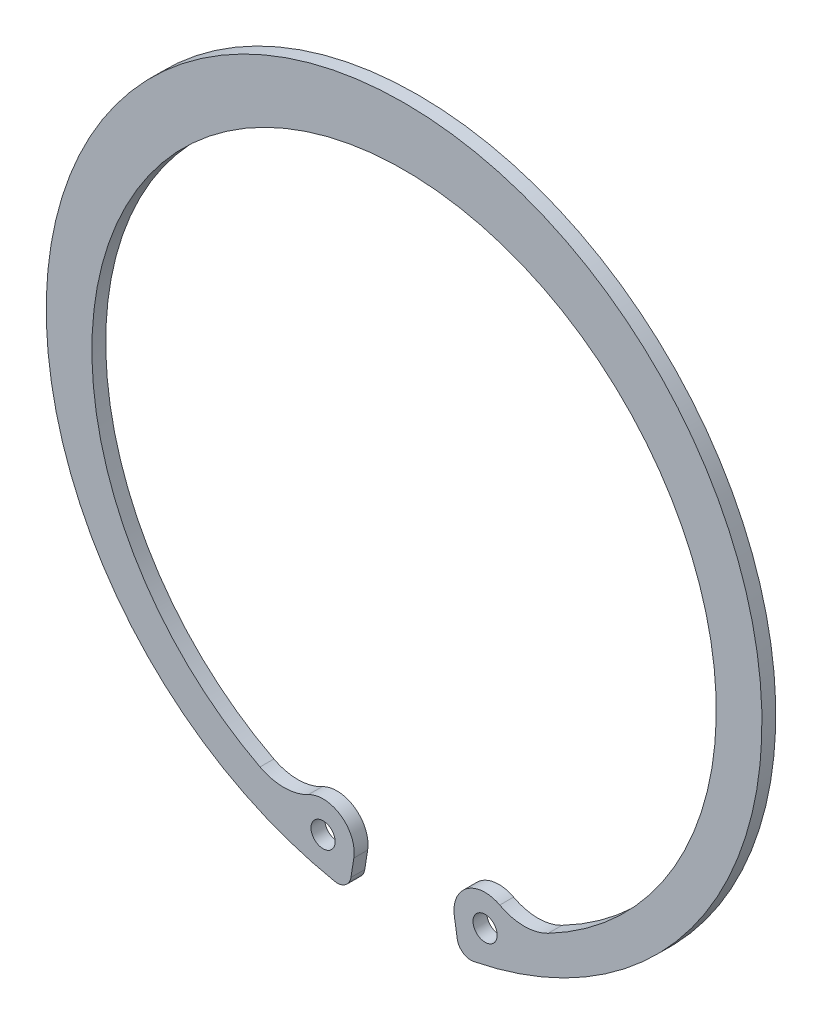
from build123d import *

# Parameters (mm, degrees)
SKETCH_3_R      = 1.75
EXTRUDE_1_DEPTH = 2


with BuildPart() as part:
    # Эскиз3 → Бобышка-Вытянуть1 (new body)
    with BuildSketch(Plane.XY):
        with BuildLine():
            Line((-7.683835559, -49.113936989), (-7.268908787, -46.475485024))
            ThreePointArc((-7.268908787, -46.475485024), (-9.10702191, -42.108671932), (-13.835351207, -41.807642867))
            ThreePointArc((-13.835351207, -41.807642867), (-17.32841073, -42.692929153), (-20.831181455, -41.846883123))
            ThreePointArc((-20.831181455, -41.846883123), (0, 43.35), (20.831181455, -41.846883123))
            ThreePointArc((20.831181455, -41.846883123), (17.32841073, -42.692929153), (13.835351207, -41.807642867))
            ThreePointArc((13.835351207, -41.807642867), (9.10702191, -42.108671932), (7.268908787, -46.475485024))
            Line((7.268908787, -46.475485024), (7.683835559, -49.113936989))
            ThreePointArc((7.683835559, -49.113936989), (8.514303087, -50.442866976), (10.047877639, -50.765171673))
            ThreePointArc((10.047877639, -50.765171673), (0, 51.75), (-10.047877639, -50.765171673))
            ThreePointArc((-10.047877639, -50.765171673), (-8.514303087, -50.442866976), (-7.683835559, -49.113936989))
        make_face()
        with Locations((-11.714274977, -45.776400308)):
            Circle(SKETCH_3_R, mode=Mode.SUBTRACT)
        with Locations((11.714274977, -45.776400308)):
            Circle(SKETCH_3_R, mode=Mode.SUBTRACT)
    extrude(amount=EXTRUDE_1_DEPTH)


solid = part.part
